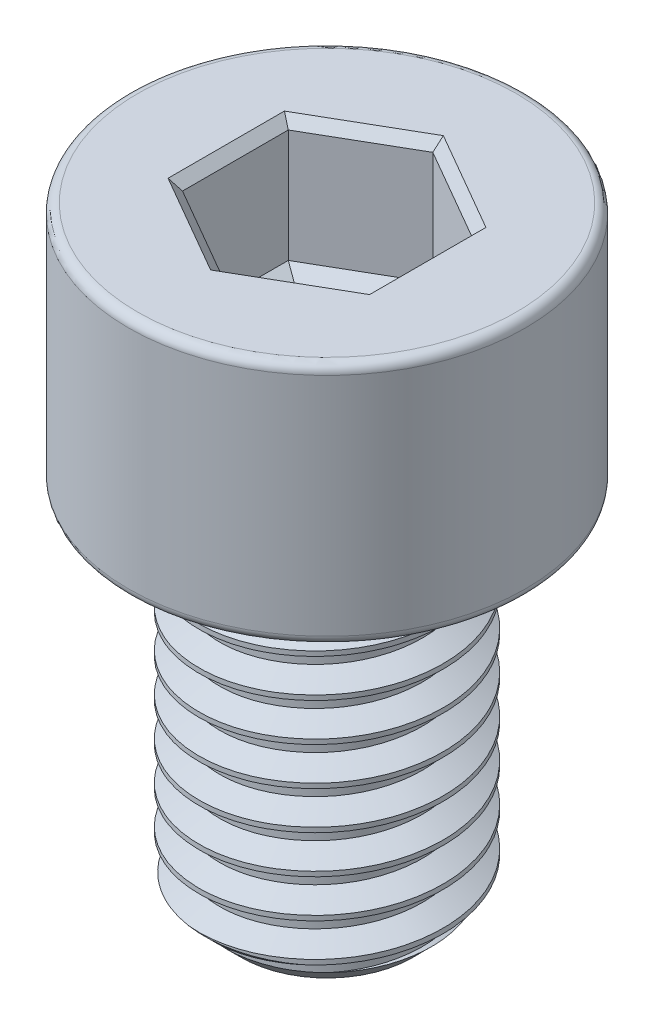
from build123d import *

# Parameters (mm, degrees)
SKETCH1_R           = 4
BOSS_EXTRUDE1_DEPTH = 12
THREAD1_PITCH       = 1.25
SKETCH2_R           = 6.5
BOSS_EXTRUDE2_DEPTH = 8
FILLET1_R           = 0.3
CUT_EXTRUDE1_DEPTH  = 4
CHAMFER1_SIZE       = 0.3
CUT_EXTRUDE2_DEPTH  = 0.4
CUT_EXTRUDE2_DRAFT  = -60


with BuildPart() as part:
    # Sketch1 → Boss-Extrude1 (new body)
    with BuildSketch(Plane(origin=(0, 0, 0), x_dir=(1, 0, 0), z_dir=(0, 1, 0))):
        with Locations(Location((0, 0, 0), (0, 0, 270))):
            Circle(SKETCH1_R)
    extrude(amount=BOSS_EXTRUDE1_DEPTH)

    # Thread1: the profile of Thread Profile1 profile screwed along a right-hand helix of 10.6 turns, 8 arcs to a turn; built about Z, then put on its axis
    thread1_z = Axis((0, 0, 0), (0, 0, 1))
    thread1_corners = [(4.0003, 0, -0.000173205), (4.0003, 0, 1.093923202), (3.323417656, 0, 0.703124998), (3.323417656, 0, 0.390624998)]
    with BuildLine(mode=Mode.PRIVATE) as thread1_profile:
        Line(thread1_corners[0], thread1_corners[1])
        Line(thread1_corners[1], thread1_corners[2])
        Line(thread1_corners[2], thread1_corners[3])
        Line(thread1_corners[3], thread1_corners[0])
    thread1_cap = Face(thread1_profile.wire())
    thread1_turn_angles = [0, 22.5, 45, 67.5, 90, 112.5, 135, 157.5, 180, 202.5, 225, 247.5, 270, 292.5, 315, 337.5, 360]
    thread1_turn_weights = [1, 0.9238795325112867, 1, 0.9238795325112867, 1, 0.9238795325112867, 1, 0.9238795325112867, 1, 0.9238795325112867, 1, 0.9238795325112867, 1, 0.9238795325112867, 1, 0.9238795325112867, 1]
    thread1_turn_rails = [Edge.make_bspline([Vector(p[0], p[1], 0).rotate(thread1_z, thread1_turn_angles[k]) / thread1_turn_weights[k] + Vector(0, 0, p[2] + THREAD1_PITCH * thread1_turn_angles[k] / 360) for k in range(17)], [0, 0, 0, 1, 1, 2, 2, 3, 3, 4, 4, 5, 5, 6, 6, 7, 7, 8, 8, 8], 2, thread1_turn_weights) for p in thread1_corners]
    thread1_turn_sides = [Face.make_surface_from_curves(thread1_turn_rails[p[0]], thread1_turn_rails[p[1]]) for p in [(0, 1), (1, 2), (2, 3), (3, 0)]]
    thread1_last_angles = [3600, 3622.5, 3645, 3667.5, 3690, 3712.5, 3735, 3757.5, 3780, 3798, 3816]
    thread1_last_weights = [1, 0.9238795325112867, 1, 0.9238795325112867, 1, 0.9238795325112867, 1, 0.9238795325112867, 1, 0.9510565162951535, 1]
    thread1_last_rails = [Edge.make_bspline([Vector(p[0], p[1], 0).rotate(thread1_z, thread1_last_angles[k]) / thread1_last_weights[k] + Vector(0, 0, p[2] + THREAD1_PITCH * thread1_last_angles[k] / 360) for k in range(11)], [0, 0, 0, 1, 1, 2, 2, 3, 3, 4, 4, 5, 5, 5], 2, thread1_last_weights) for p in thread1_corners]
    thread1_last_sides = [Face.make_surface_from_curves(thread1_last_rails[p[0]], thread1_last_rails[p[1]]) for p in [(0, 1), (1, 2), (2, 3), (3, 0)]]
    thread1 = Plane(origin=(0, 13.25, 0), x_dir=(-1, 0, 0), z_dir=(0, -1, 0)) * Solid(Shell([*[p.moved(Location((0, 0, THREAD1_PITCH * i))) for i in range(10) for p in thread1_turn_sides], *thread1_last_sides, thread1_cap, thread1_cap.rotate(thread1_z, 3816).moved(Location((0, 0, THREAD1_PITCH * 3816 / 360)))]))
    add(thread1, mode=Mode.SUBTRACT)

    # Sketch2 → Boss-Extrude2 (add)
    with BuildSketch(Plane(origin=(0, 12, 0), x_dir=(1, 0, 0), z_dir=(0, 1, 0))):
        with Locations(Location((0, 0, 0), (0, 0, 270))):
            Circle(SKETCH2_R)
    extrude(amount=BOSS_EXTRUDE2_DEPTH)

    # Sketch5 → Cut-Revolve1 (revolve, cut)
    with BuildSketch(Plane.XY, mode=Mode.PRIVATE) as cut_revolve1_sk:
        Polygon((4.01, 0), (4.01, 1.2), (2.81, 0), align=None)
    revolve(cut_revolve1_sk.sketch.rotate(Axis((0, 0, 0), (0, 1, 0)), 261.490629632), axis=Axis((0, 0, 0), (0, 1, 0)), mode=Mode.SUBTRACT)

    # Fillet1
    fillet1_edges = [part.edges().sort_by_distance(p)[0] for p in [
        (0, 12, -6.5),
        (0, 20, -6.5),
    ]]
    fillet(fillet1_edges, radius=FILLET1_R)

    # Sketch6 → Cut-Extrude1 (cut)
    with BuildSketch(Plane(origin=(0, 20, 0), x_dir=(1, 0, 0), z_dir=(0, 1, 0))):
        Polygon((0, 3.464101615), (-3, 1.732050808), (-3, -1.732050808), (0, -3.464101615), (3, -1.732050808), (3, 1.732050808), align=None)
    extrude(amount=-CUT_EXTRUDE1_DEPTH, mode=Mode.SUBTRACT)

    # Chamfer1
    chamfer1_edges = [part.edges().sort_by_distance(p)[0] for p in [
        (1.5, 20, -2.598076211),
        (-1.5, 20, -2.598076211),
        (-3, 20, 0),
        (-1.5, 20, 2.598076211),
        (1.5, 20, 2.598076211),
        (3, 20, 0),
    ]]
    chamfer(chamfer1_edges, length=CHAMFER1_SIZE)


with BuildPart() as cut_extrude2_tool:
    # Sketch7 → Cut-Extrude2 (with draft: the straight prism first)
    with BuildSketch(Plane(origin=(0, 16, 0), x_dir=(1, 0, 0), z_dir=(0, 1, 0))):
        Polygon((0, 3.464101615), (-3, 1.732050808), (-3, -1.732050808), (0, -3.464101615), (3, -1.732050808), (3, 1.732050808), align=None)
    extrude(amount=-CUT_EXTRUDE2_DEPTH)
    # Cut-Extrude2: the draft: its side faces are tilted about the plane it starts from
    cut_extrude2_sides = [cut_extrude2_tool.faces().sort_by_distance(p)[0] for p in [
        (-1.5, 15.8, -2.598076211),
        (-3, 15.8, 0),
        (-1.5, 15.8, 2.598076211),
        (1.5, 15.8, 2.598076211),
        (3, 15.8, 0),
        (1.5, 15.8, -2.598076211),
    ]]
    draft(cut_extrude2_sides, Plane(origin=(0, 16, 0), x_dir=(1, 0, 0), z_dir=(0, 1, 0)), CUT_EXTRUDE2_DRAFT)


with BuildPart() as part_1:
    add(part.part)

    # Cut-Extrude2: cut by cut_extrude2_tool
    add(cut_extrude2_tool.part, mode=Mode.SUBTRACT)


solid = part_1.part
